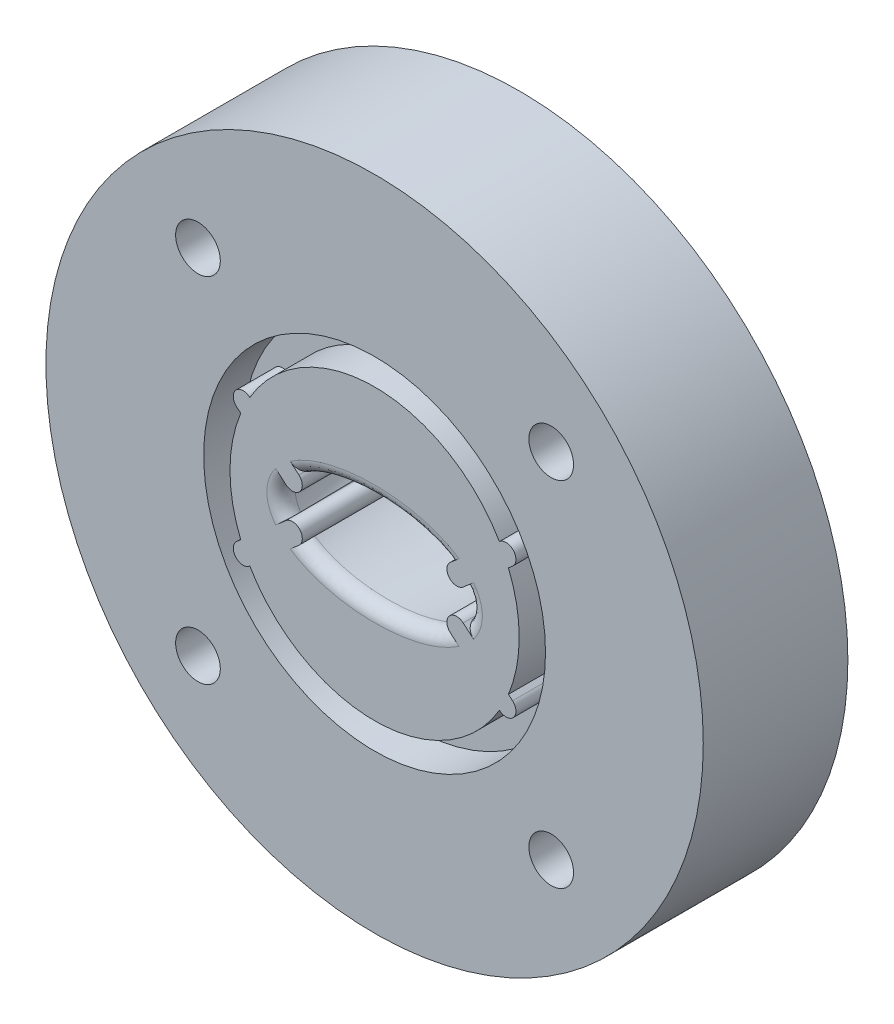
from build123d import *

# Parameters (mm, degrees)
ESQUISSE1_R             = 25
ESQUISSE1_R_2           = 1.7
BOSS_EXTRU_1_DEPTH      = 11
ESQUISSE2_R             = 13
ESQUISSE2_R_2           = 11
ENL_V_MAT_EXTRU_1_DEPTH = 3
CONG_1_R                = 1
ENL_V_START             = -3
ESQUISSE6_R             = 11
ENL_V_MAT_EXTRU_2_DEPTH = 3
CONG_2_R                = 0.5
CONG_3_R                = 0.5
ESQUISSE8_R             = 0.25
BOSS_EXTRU_4_DEPTH      = 10
BOSS_EXTRU_6_DEPTH      = 10


with BuildPart() as part:
    # Esquisse1 → Boss.-Extru.1 (new body)
    with BuildSketch(Plane.XY):
        Circle(ESQUISSE1_R)
        with Locations((-13.435028843, 13.435028843)):
            Circle(ESQUISSE1_R_2, mode=Mode.SUBTRACT)
        with Locations((13.435028843, 13.435028843)):
            Circle(ESQUISSE1_R_2, mode=Mode.SUBTRACT)
        with Locations((13.435028843, -13.435028843)):
            Circle(ESQUISSE1_R_2, mode=Mode.SUBTRACT)
        with Locations((-13.435028843, -13.435028843)):
            Circle(ESQUISSE1_R_2, mode=Mode.SUBTRACT)
    extrude(amount=BOSS_EXTRU_1_DEPTH)

    # Enlèvement de matière-Lissage1: read off the stored shape, not the designer's step
    # Enlèvement de matière-Lissage1: loft between two sections, ruled curve by curve
    enl_vement_de_mati_re_lissage1_from = [
        Edge.make_bspline([(0.092172425, -3.999790223, 0), (18.091228427, -3.917859178, 0), (17.906883578, 4.081721267, 0), (-0.092172425, 3.999790223, 0), (-18.091228427, 3.917859178, 0), (-17.906883578, -4.081721267, 0), (0.092172425, -3.999790223, 0)], [0, 0, 0, 0, 0.5, 0.5, 0.5, 1, 1, 1, 1], 3, [1, 0.333333333, 0.333333333, 1, 0.333333333, 0.333333333, 1]),
    ]
    enl_vement_de_mati_re_lissage1_to = [
        Edge.make_bspline([(-0.165571743, -3.499020792, 11), (13.830511423, -3.664592535, 11), (14.161654909, 3.333449048, 11), (0.165571743, 3.499020792, 11), (-13.830511423, 3.664592535, 11), (-14.161654909, -3.333449048, 11), (-0.165571743, -3.499020792, 11)], [0, 0, 0, 0, 0.5, 0.5, 0.5, 1, 1, 1, 1], 3, [1, 0.333333333, 0.333333333, 1, 0.333333333, 0.333333333, 1]),
    ]
    enl_vement_de_mati_re_lissage1 = Solid(Shell([*[Face.make_surface_from_curves(enl_vement_de_mati_re_lissage1_from[k], enl_vement_de_mati_re_lissage1_to[k]) for k in range(1)], Face(Wire(enl_vement_de_mati_re_lissage1_from)), Face(Wire(enl_vement_de_mati_re_lissage1_to))]))
    add(enl_vement_de_mati_re_lissage1, mode=Mode.SUBTRACT)

    # Esquisse2 → Enlèv. mat.-Extru.1 (cut)
    with BuildSketch(Plane.XY.offset(11)):
        Circle(ESQUISSE2_R)
        Circle(ESQUISSE2_R_2, mode=Mode.SUBTRACT)
    extrude(amount=-ENL_V_MAT_EXTRU_1_DEPTH, mode=Mode.SUBTRACT)

    # Congé1
    cong_1_edges = [part.edges().sort_by_distance(p)[0] for p in [
        (0.165571743, 3.499020792, 11),
    ]]
    fillet(cong_1_edges, radius=CONG_1_R)

    # Esquisse6 → Enlèv. mat.-Extru.2 (cut)
    with BuildSketch(Plane(origin=(0, 0, 0), x_dir=(-1, 0, 0), z_dir=(0, 0, -1)).offset(ENL_V_START)):
        with Locations(Location((0, 0, 0), (0, 0, 180))):
            Circle(ESQUISSE6_R)
    extrude(amount=ENL_V_MAT_EXTRU_2_DEPTH, mode=Mode.SUBTRACT)

    # Congé2
    cong_2_edges = [part.edges().sort_by_distance(p)[0] for p in [
        (-11, 0, 3),
    ]]
    fillet(cong_2_edges, radius=CONG_2_R)

    # Congé3
    cong_3_edges = [part.edges().sort_by_distance(p)[0] for p in [
        (-0.021878561, 3.863216915, 3),
    ]]
    fillet(cong_3_edges, radius=CONG_3_R)

    # Esquisse8 → Boss.-Extru.4 (add)
    with BuildSketch(Plane.XY.offset(11)):
        with Locations((-6.25, 1.75)):
            Circle(ESQUISSE8_R)
        with Locations((-6.25, -1.75)):
            Circle(ESQUISSE8_R)
        with Locations((6.25, 1.75)):
            Circle(ESQUISSE8_R)
        with Locations((6.25, -1.75)):
            Circle(ESQUISSE8_R)
    extrude(amount=-BOSS_EXTRU_4_DEPTH)

    # Esquisse10 → Boss.-Extru.6 (add)
    with BuildSketch(Plane.XY.offset(11)):
        with BuildLine():
            Line((-5.758802096, -2.316766812), (-9.508802096, -5.566766812))
            ThreePointArc((-9.508802096, -5.566766812), (-10.566766812, -5.491197904), (-10.491197904, -4.433233188))
            Line((-10.491197904, -4.433233188), (-6.741197904, -1.183233188))
            ThreePointArc((-6.741197904, -1.183233188), (-5.683233188, -1.258802096), (-5.758802096, -2.316766812))
        make_face()
        with BuildLine():
            Line((-6.741197904, 1.183233188), (-10.491197904, 4.433233188))
            ThreePointArc((-10.491197904, 4.433233188), (-10.566766812, 5.491197904), (-9.508802096, 5.566766812))
            Line((-9.508802096, 5.566766812), (-5.758802096, 2.316766812))
            ThreePointArc((-5.758802096, 2.316766812), (-5.683233188, 1.258802096), (-6.741197904, 1.183233188))
        make_face()
        with BuildLine():
            Line((9.508802096, -5.566766812), (5.758802096, -2.316766812))
            ThreePointArc((5.758802096, -2.316766812), (5.683233188, -1.258802096), (6.741197904, -1.183233188))
            Line((6.741197904, -1.183233188), (10.491197904, -4.433233188))
            ThreePointArc((10.491197904, -4.433233188), (10.566766812, -5.491197904), (9.508802096, -5.566766812))
        make_face()
        with BuildLine():
            Line((10.491197904, 4.433233188), (6.741197904, 1.183233188))
            ThreePointArc((6.741197904, 1.183233188), (5.683233188, 1.258802096), (5.758802096, 2.316766812))
            Line((5.758802096, 2.316766812), (9.508802096, 5.566766812))
            ThreePointArc((9.508802096, 5.566766812), (10.566766812, 5.491197904), (10.491197904, 4.433233188))
        make_face()
    extrude(amount=-BOSS_EXTRU_6_DEPTH)


solid = part.part
